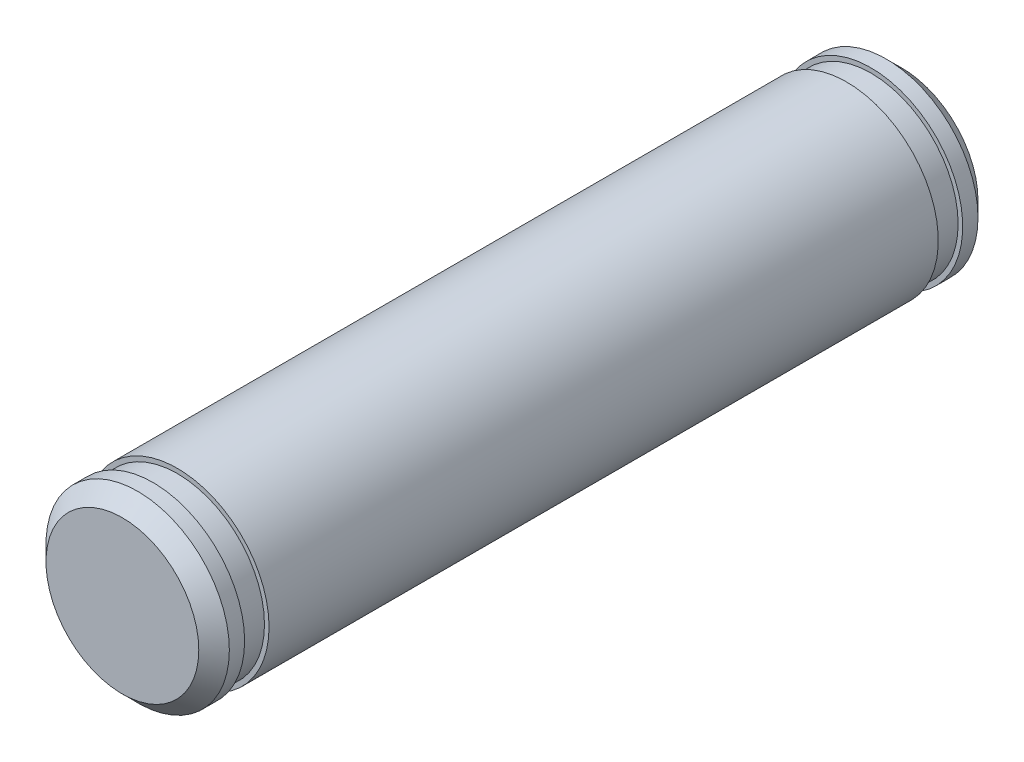
from build123d import *

# Parameters (mm, degrees)
SZKIC1_R                    = 3
DODANIE_WYCI_GNI_CIE1_DEPTH = 25.5
SFAZOWANIE1_SIZE            = 0.5
WYTNIJ_WYCI_GNI_CIE1_START  = -1.8
SZKIC2_R                    = 3
SZKIC2_R_2                  = 2.85
WYTNIJ_WYCI_GNI_CIE1_DEPTH  = 0.8
WYTNIJ_WYCI_GNI_CIE2_START  = -1
SZKIC3_R                    = 3
SZKIC3_R_2                  = 2.85
WYTNIJ_WYCI_GNI_CIE2_DEPTH  = 0.8


with BuildPart() as part:
    # Szkic1 → Dodanie-wyciągnięcie1 (new body)
    with BuildSketch(Plane.XY):
        Circle(SZKIC1_R)
    extrude(amount=DODANIE_WYCI_GNI_CIE1_DEPTH)

    # Sfazowanie1
    sfazowanie1_edges = [part.edges().sort_by_distance(p)[0] for p in [
        (-3, 0, 0),
        (-3, 0, 25.5),
    ]]
    chamfer(sfazowanie1_edges, length=SFAZOWANIE1_SIZE)

    # Szkic2 → Wytnij-wyciągnięcie1 (cut)
    with BuildSketch(Plane.XY.offset(25.5).offset(WYTNIJ_WYCI_GNI_CIE1_START)):
        Circle(SZKIC2_R)
        Circle(SZKIC2_R_2, mode=Mode.SUBTRACT)
    extrude(amount=WYTNIJ_WYCI_GNI_CIE1_DEPTH, mode=Mode.SUBTRACT)

    # Szkic3 → Wytnij-wyciągnięcie2 (cut)
    with BuildSketch(Plane(origin=(0, 0, 0), x_dir=(-1, 0, 0), z_dir=(0, 0, -1)).offset(WYTNIJ_WYCI_GNI_CIE2_START)):
        Circle(SZKIC3_R)
        Circle(SZKIC3_R_2, mode=Mode.SUBTRACT)
    extrude(amount=-WYTNIJ_WYCI_GNI_CIE2_DEPTH, mode=Mode.SUBTRACT)


solid = part.part
